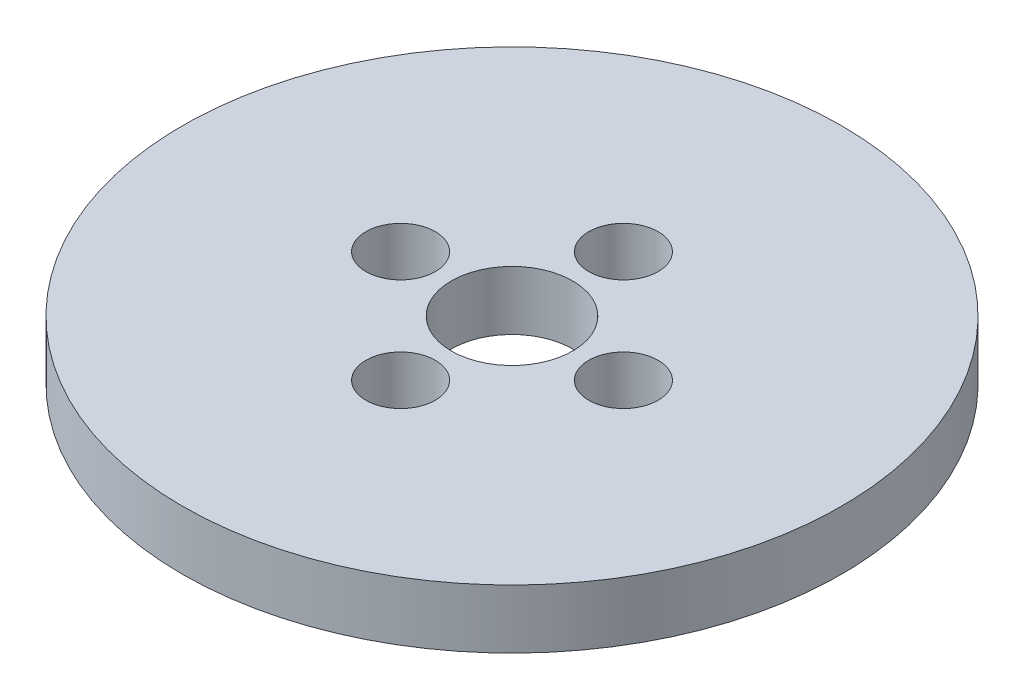
from build123d import *

# Parameters (mm, degrees)
SKETCH1_R           = 95
BOSS_EXTRUDE1_DEPTH = 17
SKETCH2_R           = 17.5
CUT_EXTRUDE1_DEPTH  = 136.421564014
SKETCH3_R           = 10
CUT_EXTRUDE2_DEPTH  = 16.43458021
CIRPATTERN1_COUNT   = 4


with BuildPart() as part:
    # Sketch1 → Boss-Extrude1 (new body)
    with BuildSketch(Plane(origin=(0, 0, 0), x_dir=(1, 0, 0), z_dir=(0, 1, 0))):
        Circle(SKETCH1_R)
    extrude(amount=BOSS_EXTRUDE1_DEPTH)

    # Sketch2 → Cut-Extrude1 (cut, through all)
    with BuildSketch(Plane(origin=(0, 0, 0), x_dir=(1, 0, 0), z_dir=(0, 1, 0))):
        Circle(SKETCH2_R)
    extrude(amount=CUT_EXTRUDE1_DEPTH, mode=Mode.SUBTRACT)

    # Sketch3 → Cut-Extrude2 (cut)
    with BuildSketch(Plane(origin=(0, 17, 0), x_dir=(1, 0, 0), z_dir=(0, 1, 0))):
        with Locations((-32.115829906, 0)):
            Circle(SKETCH3_R)
    cut_extrude2 = extrude(amount=-CUT_EXTRUDE2_DEPTH, mode=Mode.SUBTRACT)

    # CirPattern1: Cut-Extrude2 ×4 about axis
    cirpattern1_axis = Axis((0, 0, 0), (0, 1, 0))
    for i in range(1, CIRPATTERN1_COUNT):
        add(cut_extrude2.rotate(cirpattern1_axis, i * 360 / CIRPATTERN1_COUNT), mode=Mode.SUBTRACT)


solid = part.part
